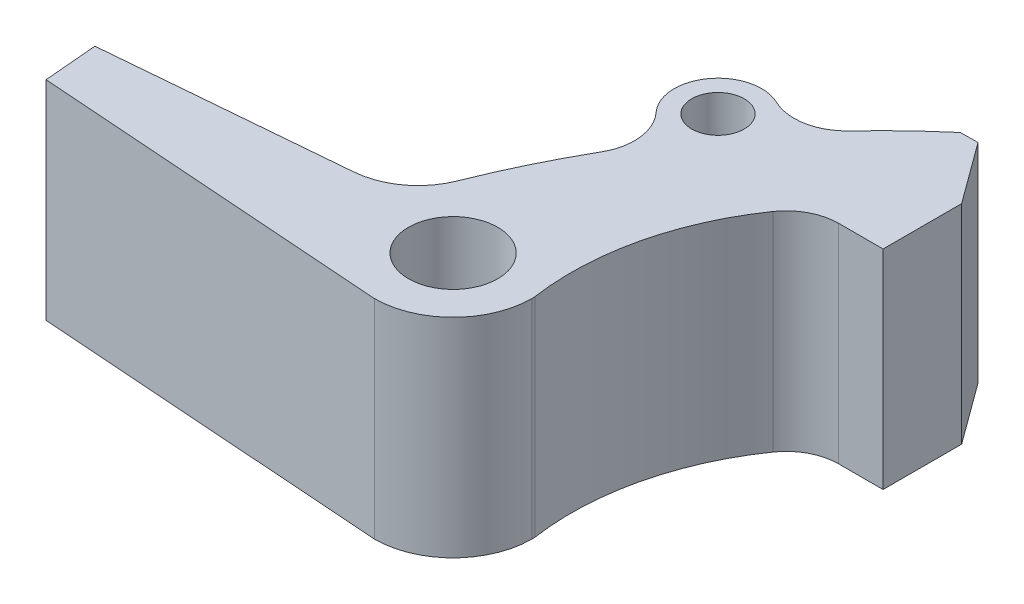
from build123d import *

# Parameters (mm, degrees)
SKETCH1_R           = 2.55
SKETCH1_R_2         = 1.5
BOSS_EXTRUDE1_DEPTH = 11.9
SKETCH2_R           = 4
CUT_EXTRUDE1_DEPTH  = 3
FILLET1_R           = 10


with BuildPart() as part:
    # Sketch1 → Boss-Extrude1 (new body)
    with BuildSketch(Plane(origin=(0, 0, 0), x_dir=(1, 0, 0), z_dir=(0, 1, 0))):
        with BuildLine():
            Line((9.548719517, 20.446351577), (8.548719517, 20.439520648))
            ThreePointArc((8.548719517, 20.439520648), (6.873073378, 18.92667054), (5.279413844, 17.32768501))
            ThreePointArc((5.279413844, 17.32768501), (3.641729047, 16.438171118), (1.79479604, 16.687339585))
            ThreePointArc((1.79479604, 16.687339585), (-1.298720161, 15.927784086), (-1.135127046, 12.74658866))
            ThreePointArc((-1.135127046, 12.74658866), (-0.36458096, 11.049678177), (-0.744733852, 9.225197364))
            ThreePointArc((-0.744733852, 9.225197364), (-2.181853542, 6.500169129), (-3.4195031, 3.678943251))
            ThreePointArc((-3.4195031, 3.678943251), (-4.750151746, 1.944049699), (-6.794216917, 1.167983317))
            Line((-6.794216917, 1.167983317), (-20.434932532, -0.008444123))
            Line((-20.434932532, -0.008444123), (-20.171389856, -3.064230295))
            Line((-20.171389856, -3.064230295), (-0.61568325, -4.46265538))
            Line((-0.61568325, -4.46265538), (0.024630797, -4.508444123))
            ThreePointArc((0.024630797, -4.508444123), (3.206611312, -3.190424639), (4.524630797, -0.008444123))
            ThreePointArc((4.524630797, -0.008444123), (4.522964187, 0.074936031), (4.52153968, 0.158320674))
            ThreePointArc((4.52153968, 0.158320674), (4.763290961, 5.914837028), (7.103103866, 11.179929599))
            ThreePointArc((7.103103866, 11.179929599), (8.177074896, 12.128306877), (9.568395932, 12.47044575))
            Line((9.568395932, 12.47044575), (12.103260685, 12.47044575))
            Line((12.103260685, 12.47044575), (12.103260685, 16.957695738))
            Line((12.103260685, 16.957695738), (9.548719517, 20.446351577))
        make_face()
        with Locations(Location((0.024630797, -0.008444123, 0), (0, 0, 270))):
            Circle(SKETCH1_R, mode=Mode.SUBTRACT)
        with Locations(Location((0.707528049, 14.436151384, 0), (0, 0, 270))):
            Circle(SKETCH1_R_2, mode=Mode.SUBTRACT)
    extrude(amount=BOSS_EXTRUDE1_DEPTH)

    # Sketch2 → Cut-Extrude1 (cut, symmetric)
    with BuildSketch(Plane(origin=(0, 5.59, 0), x_dir=(1, 0, 0), z_dir=(0, 1, 0))):
        with Locations((0.707528049, 14.436151384)):
            Circle(SKETCH2_R)
    extrude(amount=CUT_EXTRUDE1_DEPTH, both=True, mode=Mode.SUBTRACT)

    # Fillet1
    # the kernel refuses this fillet: 10 mm, written as the material it takes off along each edge
    with BuildSketch(Plane(origin=(4.097372756, 8.59, -16.55958089), x_dir=(0.7539501243329342, 0, -0.6569316631266551), z_dir=(0, -1, 0))) as fillet1_piece_1:
        with BuildLine():
            CenterArc((5.165347529, 9.999376692), FILLET1_R, 229.371801611, 39.988476575)
            Line((-1.346130645, 2.409867354), (-1.997278462, 1.650916421))
            ThreePointArc((-1.997278462, 1.650916421), (-1.331632365, 0.837063937), (-0.987680479, -0.156484095))
            Line((-0.987680479, -0.156484095), (0.368749302, -0.929528887))
            ThreePointArc((0.368749302, -0.929528887), (1.299277263, -0.79792354), (5.042532309, -0.999937669))
            Line((5.042532309, -0.999937669), (5.053697329, 0))
        make_face()
    extrude(amount=6, mode=Mode.SUBTRACT)
    with BuildSketch(Plane(origin=(-0.34961624, 8.59, -10.578374051), x_dir=(-0.41195039334505656, 0, 0.9112062738056916), z_dir=(0, -1, 0))) as fillet1_piece_2:
        with BuildLine():
            CenterArc((5.165347529, -9.999376692), FILLET1_R, 90.639721814, 39.988476575)
            Line((-1.346130645, -2.409867354), (-1.997278462, -1.650916421))
            ThreePointArc((-1.997278462, -1.650916421), (-1.331632365, -0.837063937), (-0.987680479, 0.156484095))
            Line((-0.987680479, 0.156484095), (0.368749302, 0.929528887))
            ThreePointArc((0.368749302, 0.929528887), (1.299277263, 0.79792354), (5.042532309, 0.999937669))
            Line((5.042532309, 0.999937669), (5.053697329, 0))
        make_face()
    extrude(amount=6, mode=Mode.SUBTRACT)


solid = part.part
